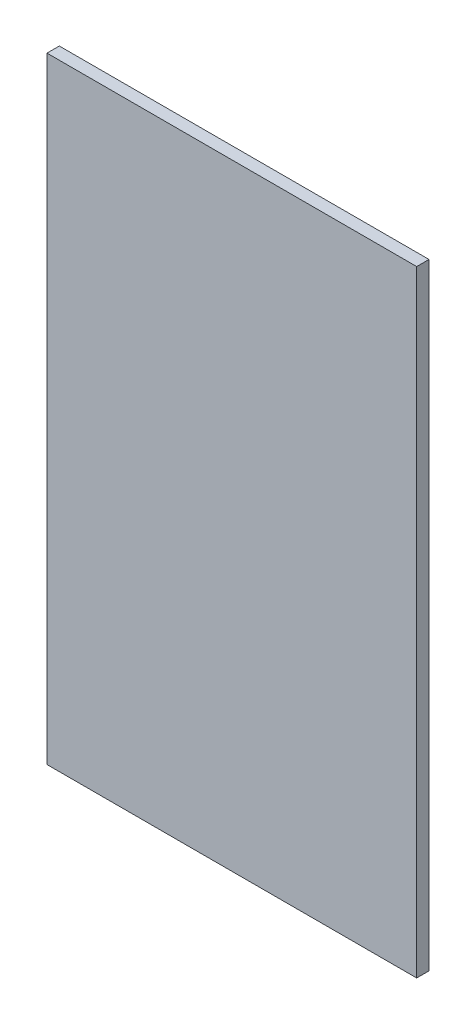
from build123d import *

# Parameters (mm, degrees)
ESQUISSE1_W        = 900
ESQUISSE1_H        = 1500
BOSS_EXTRU_1_DEPTH = 30


with BuildPart() as part:
    # Esquisse1 → Boss.-Extru.1 (new body)
    with BuildSketch(Plane.XY):
        with Locations((450, 750)):
            Rectangle(ESQUISSE1_W, ESQUISSE1_H)
    extrude(amount=BOSS_EXTRU_1_DEPTH)


solid = part.part
